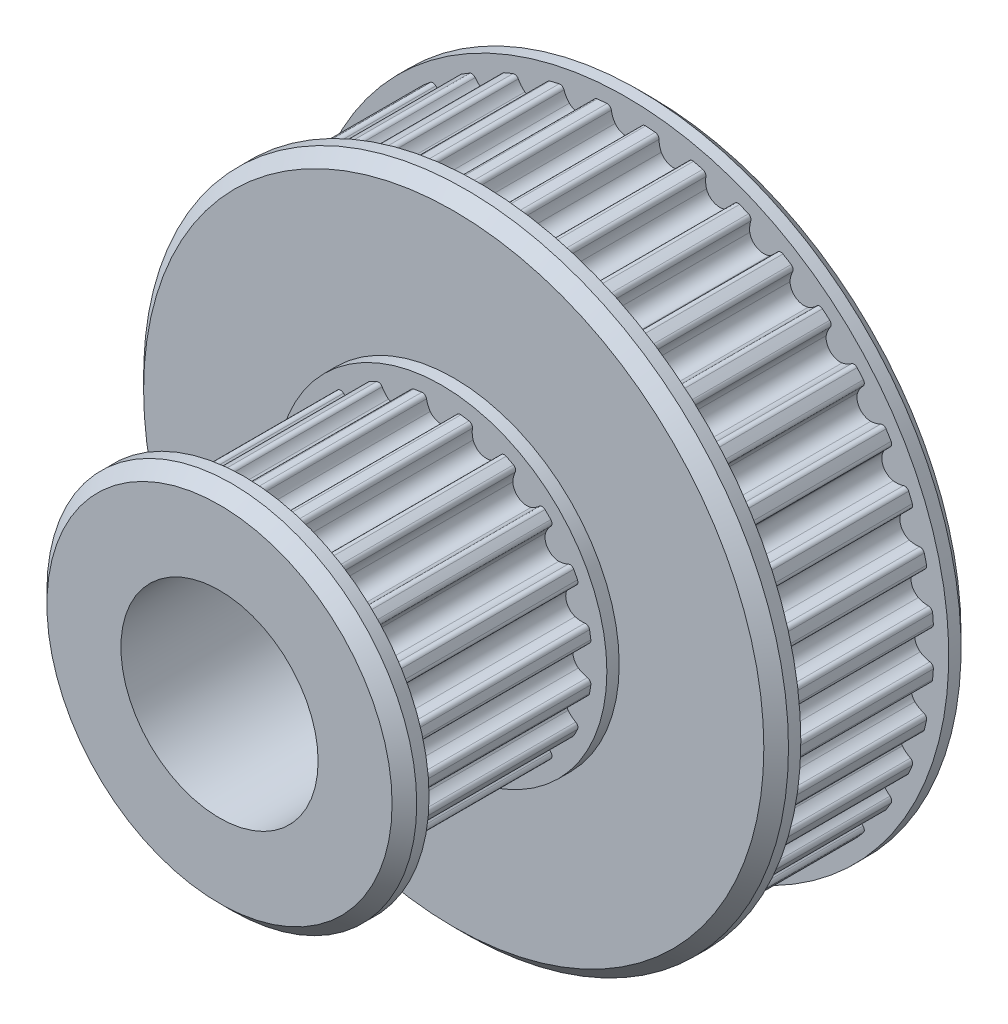
from build123d import *

# Parameters (mm, degrees)
SKETCH1_R                = 12.478406202
BOSS_EXTRUDE1_DEPTH      = 6
CUT_EXTRUDE1_START       = -8
CUT_EXTRUDE1_DEPTH       = 8
FILLET1_R                = 0.17
CIRPATTERN1_COUNT        = 40
FILLET1_OF_CIRPATTERN1_R = 0.17
SKETCH3_R                = 13.078406202
BOSS_EXTRUDE2_DEPTH      = 1
BOSS_EXTRUDE3_START      = 1
SKETCH4_R                = 13.078406202
BOSS_EXTRUDE3_DEPTH      = 1
CHAMFER1_SIZE            = 0.5
SKETCH5_R                = 6.712203101
BOSS_EXTRUDE4_DEPTH      = 0.5
SKETCH6_R                = 6.112203101
BOSS_EXTRUDE5_DEPTH      = 8
CUT_EXTRUDE2_START       = -8
CUT_EXTRUDE2_DEPTH       = 8
FILLET4_R                = 0.17
CIRPATTERN2_COUNT        = 20
FILLET4_OF_CIRPATTERN2_R = 0.17
SKETCH8_R                = 6.712203101
BOSS_EXTRUDE6_DEPTH      = 1
SKETCH9_R                = 4
CUT_EXTRUDE3_DEPTH       = 26.462510143
SKETCH13_R               = 7.5
SKETCH13_R_2             = 4
BOSS_EXTRUDE7_DEPTH      = 1
CHAMFER2_SIZE            = 0.5


with BuildPart() as part:
    # Sketch1 → Boss-Extrude1 (new body)
    with BuildSketch(Plane.XY):
        Circle(SKETCH1_R)
    extrude(amount=BOSS_EXTRUDE1_DEPTH)

    # Sketch2 → Cut-Extrude1 (cut)
    with BuildSketch(Plane.XY.offset(6).offset(CUT_EXTRUDE1_START)):
        with BuildLine():
            ThreePointArc((0.619883643, 12.462999864), (0, 12.478406202), (-0.619883643, 12.462999864))
            ThreePointArc((-0.619883643, 12.462999864), (-0.57527485, 12.179677284), (-0.453553699, 11.919974395))
            ThreePointArc((-0.453553699, 11.919974395), (0, 11.698406202), (0.453553699, 11.919974395))
            ThreePointArc((0.453553699, 11.919974395), (0.57527485, 12.179677284), (0.619883643, 12.462999864))
        make_face()
    cut_extrude1 = extrude(amount=CUT_EXTRUDE1_DEPTH, mode=Mode.SUBTRACT)

    # Fillet1
    fillet1_edges = [part.edges().sort_by_distance(p)[0] for p in [
        (0.619883643, 12.462999864, 3),
        (-0.619883643, 12.462999864, 3),
    ]]
    fillet(fillet1_edges, radius=FILLET1_R)

    # CirPattern1: Cut-Extrude1 ×40 about axis
    cirpattern1_axis = Axis((0, 0, 6), (0, 0, -1))
    for i in range(1, CIRPATTERN1_COUNT):
        add(cut_extrude1.rotate(cirpattern1_axis, i * 360 / CIRPATTERN1_COUNT), mode=Mode.SUBTRACT)

    # Fillet1 of CirPattern1
    fillet1_of_cirpattern1_edges = [part.edges().sort_by_distance(p)[0] for p in [
        (2.561894563, 12.212588488, 3),
        (1.33739087, 12.406530821, 3),
        (4.440823137, 11.661462653, 3),
        (3.261734381, 12.044571813, 3),
        (6.210403906, 10.823192905, 3),
        (5.105763167, 11.386035475, 3),
        (7.827063921, 9.718420228, 3),
        (6.824071118, 10.447137154, 3),
        (9.250995645, 8.37434779, 3),
        (8.37434779, 9.250995645, 3),
        (10.447137154, 6.824071118, 3),
        (9.718420228, 7.827063921, 3),
        (11.386035475, 5.105763167, 3),
        (10.823192905, 6.210403906, 3),
        (12.044571813, 3.261734381, 3),
        (11.661462653, 4.440823137, 3),
        (12.406530821, 1.33739087, 3),
        (12.212588488, 2.561894563, 3),
        (12.462999864, -0.619883643, 3),
        (12.462999864, 0.619883643, 3),
        (12.212588488, -2.561894563, 3),
        (12.406530821, -1.33739087, 3),
        (11.661462653, -4.440823137, 3),
        (12.044571813, -3.261734381, 3),
        (10.823192905, -6.210403906, 3),
        (11.386035475, -5.105763167, 3),
        (9.718420228, -7.827063921, 3),
        (10.447137154, -6.824071118, 3),
        (8.37434779, -9.250995645, 3),
        (9.250995645, -8.37434779, 3),
        (6.824071118, -10.447137154, 3),
        (7.827063921, -9.718420228, 3),
        (5.105763167, -11.386035475, 3),
        (6.210403906, -10.823192905, 3),
        (3.261734381, -12.044571813, 3),
        (4.440823137, -11.661462653, 3),
        (1.33739087, -12.406530821, 3),
        (2.561894563, -12.212588488, 3),
        (-0.619883643, -12.462999864, 3),
        (0.619883643, -12.462999864, 3),
        (-2.561894563, -12.212588488, 3),
        (-1.33739087, -12.406530821, 3),
        (-4.440823137, -11.661462653, 3),
        (-3.261734381, -12.044571813, 3),
        (-6.210403906, -10.823192905, 3),
        (-5.105763167, -11.386035475, 3),
        (-7.827063921, -9.718420228, 3),
        (-6.824071118, -10.447137154, 3),
        (-9.250995645, -8.37434779, 3),
        (-8.37434779, -9.250995645, 3),
        (-10.447137154, -6.824071118, 3),
        (-9.718420228, -7.827063921, 3),
        (-11.386035475, -5.105763167, 3),
        (-10.823192905, -6.210403906, 3),
        (-12.044571813, -3.261734381, 3),
        (-11.661462653, -4.440823137, 3),
        (-12.406530821, -1.33739087, 3),
        (-12.212588488, -2.561894563, 3),
        (-12.462999864, 0.619883643, 3),
        (-12.462999864, -0.619883643, 3),
        (-12.212588488, 2.561894563, 3),
        (-12.406530821, 1.33739087, 3),
        (-11.661462653, 4.440823137, 3),
        (-12.044571813, 3.261734381, 3),
        (-10.823192905, 6.210403906, 3),
        (-11.386035475, 5.105763167, 3),
        (-9.718420228, 7.827063921, 3),
        (-10.447137154, 6.824071118, 3),
        (-8.37434779, 9.250995645, 3),
        (-9.250995645, 8.37434779, 3),
        (-6.824071118, 10.447137154, 3),
        (-7.827063921, 9.718420228, 3),
        (-5.105763167, 11.386035475, 3),
        (-6.210403906, 10.823192905, 3),
        (-3.261734381, 12.044571813, 3),
        (-4.440823137, 11.661462653, 3),
        (-1.33739087, 12.406530821, 3),
        (-2.561894563, 12.212588488, 3),
    ]]
    fillet(fillet1_of_cirpattern1_edges, radius=FILLET1_OF_CIRPATTERN1_R)

    # Sketch3 → Boss-Extrude2 (add)
    with BuildSketch(Plane.XY.offset(6)):
        Circle(SKETCH3_R)
    extrude(amount=BOSS_EXTRUDE2_DEPTH)

    # Sketch4 → Boss-Extrude3 (add)
    with BuildSketch(Plane(origin=(0, 0, 0), x_dir=(-1, 0, 0), z_dir=(0, 0, -1)).offset(BOSS_EXTRUDE3_START)):
        Circle(SKETCH4_R)
    extrude(amount=-BOSS_EXTRUDE3_DEPTH)

    # Chamfer1
    chamfer1_edges = [part.edges().sort_by_distance(p)[0] for p in [
        (-13.078406202, 0, 7),
        (13.078406202, 0, -1),
    ]]
    chamfer(chamfer1_edges, length=CHAMFER1_SIZE)

    # Sketch5 → Boss-Extrude4 (add)
    with BuildSketch(Plane.XY.offset(7)):
        Circle(SKETCH5_R)
    extrude(amount=BOSS_EXTRUDE4_DEPTH)

    # Sketch6 → Boss-Extrude5 (add)
    with BuildSketch(Plane.XY.offset(7.5)):
        Circle(SKETCH6_R)
    extrude(amount=BOSS_EXTRUDE5_DEPTH)

    # Sketch7 → Cut-Extrude2 (cut)
    with BuildSketch(Plane.XY.offset(15.5).offset(CUT_EXTRUDE2_START)):
        with BuildLine():
            ThreePointArc((0.619514195, 6.080726018), (0, 6.112203101), (-0.619514195, 6.080726018))
            ThreePointArc((-0.619514195, 6.080726018), (-0.572890618, 5.805798391), (-0.453553699, 5.553771294))
            ThreePointArc((-0.453553699, 5.553771294), (0, 5.332203101), (0.453553699, 5.553771294))
            ThreePointArc((0.453553699, 5.553771294), (0.572890618, 5.805798391), (0.619514195, 6.080726018))
        make_face()
    cut_extrude2 = extrude(amount=CUT_EXTRUDE2_DEPTH, mode=Mode.SUBTRACT)

    # Fillet4
    fillet4_edges = [part.edges().sort_by_distance(p)[0] for p in [
        (0.619514195, 6.080726018, 11.5),
        (-0.619514195, 6.080726018, 11.5),
    ]]
    fillet(fillet4_edges, radius=FILLET4_R)

    # CirPattern2: Cut-Extrude2 ×20 about axis
    cirpattern2_axis = Axis((0, 0, 15.5), (0, 0, -1))
    for i in range(1, CIRPATTERN2_COUNT):
        add(cut_extrude2.rotate(cirpattern2_axis, i * 360 / CIRPATTERN2_COUNT), mode=Mode.SUBTRACT)

    # Fillet4 of CirPattern2
    fillet4_of_cirpattern2_edges = [part.edges().sort_by_distance(p)[0] for p in [
        (2.46824069, 5.591673689, 11.5),
        (1.289854666, 5.974554518, 11.5),
        (4.075358589, 4.55526938, 11.5),
        (3.072963565, 5.283551994, 11.5),
        (5.283551994, 3.072963565, 11.5),
        (4.55526938, 4.075358589, 11.5),
        (5.974554518, 1.289854666, 11.5),
        (5.591673689, 2.46824069, 11.5),
        (6.080726018, -0.619514195, 11.5),
        (6.080726018, 0.619514195, 11.5),
        (5.591673689, -2.46824069, 11.5),
        (5.974554518, -1.289854666, 11.5),
        (4.55526938, -4.075358589, 11.5),
        (5.283551994, -3.072963565, 11.5),
        (3.072963565, -5.283551994, 11.5),
        (4.075358589, -4.55526938, 11.5),
        (1.289854666, -5.974554518, 11.5),
        (2.46824069, -5.591673689, 11.5),
        (-0.619514195, -6.080726018, 11.5),
        (0.619514195, -6.080726018, 11.5),
        (-2.46824069, -5.591673689, 11.5),
        (-1.289854666, -5.974554518, 11.5),
        (-4.075358589, -4.55526938, 11.5),
        (-3.072963565, -5.283551994, 11.5),
        (-5.283551994, -3.072963565, 11.5),
        (-4.55526938, -4.075358589, 11.5),
        (-5.974554518, -1.289854666, 11.5),
        (-5.591673689, -2.46824069, 11.5),
        (-6.080726018, 0.619514195, 11.5),
        (-6.080726018, -0.619514195, 11.5),
        (-5.591673689, 2.46824069, 11.5),
        (-5.974554518, 1.289854666, 11.5),
        (-4.55526938, 4.075358589, 11.5),
        (-5.283551994, 3.072963565, 11.5),
        (-3.072963565, 5.283551994, 11.5),
        (-4.075358589, 4.55526938, 11.5),
        (-1.289854666, 5.974554518, 11.5),
        (-2.46824069, 5.591673689, 11.5),
    ]]
    fillet(fillet4_of_cirpattern2_edges, radius=FILLET4_OF_CIRPATTERN2_R)

    # Sketch8 → Boss-Extrude6 (add)
    with BuildSketch(Plane.XY.offset(15.5)):
        Circle(SKETCH8_R)
    extrude(amount=BOSS_EXTRUDE6_DEPTH)

    # Sketch9 → Cut-Extrude3 (cut, through all)
    with BuildSketch(Plane.XY.offset(16.5)):
        Circle(SKETCH9_R)
    extrude(amount=-CUT_EXTRUDE3_DEPTH, mode=Mode.SUBTRACT)

    # Sketch13 → Boss-Extrude7 (add)
    with BuildSketch(Plane.XY.offset(16.5)):
        Circle(SKETCH13_R)
        Circle(SKETCH13_R_2, mode=Mode.SUBTRACT)
    extrude(amount=-BOSS_EXTRUDE7_DEPTH)

    # Chamfer2
    chamfer2_edges = [part.edges().sort_by_distance(p)[0] for p in [
        (-7.5, 0, 16.5),
    ]]
    chamfer(chamfer2_edges, length=CHAMFER2_SIZE)


solid = part.part
